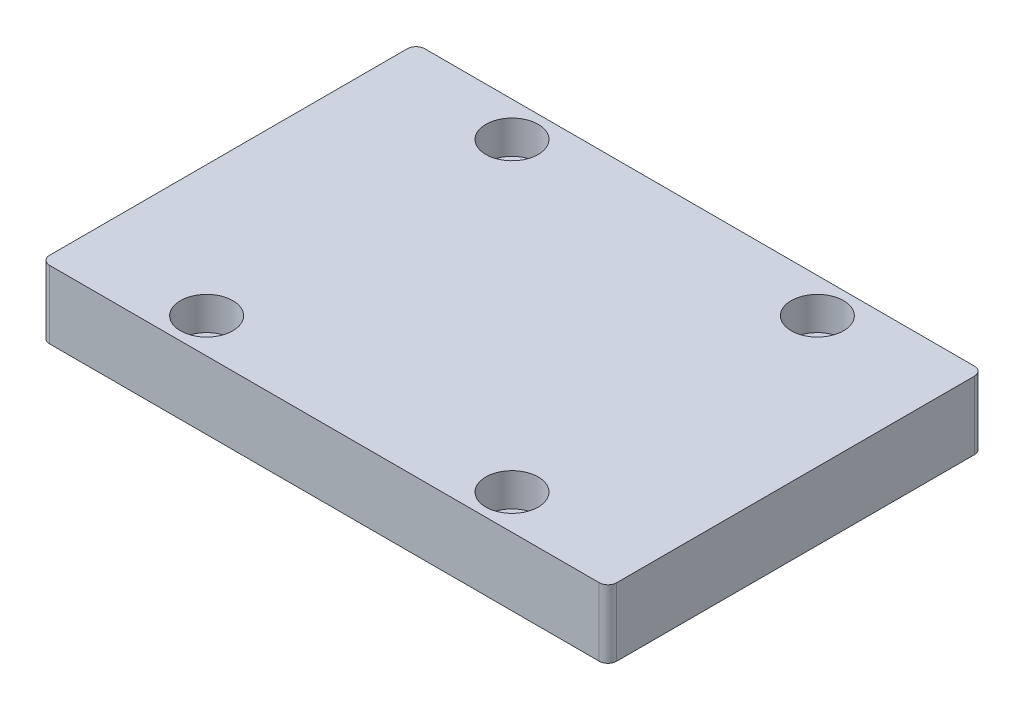
from build123d import *

# Parameters (mm, degrees)
SKETCH2_W           = 65
SKETCH2_H           = 43
BOSS_EXTRUDE1_DEPTH = 7.8
FILLET1_R           = 1
CUT_EXTRUDE1_REACH  = 41.741
SKETCH3_R           = 1.6
SKETCH4_R           = 3
CUT_EXTRUDE2_DEPTH  = 3.8


with BuildPart() as part:
    # Sketch2 → Boss-Extrude1 (new body)
    with BuildSketch(Plane(origin=(0, 0, 0), x_dir=(1, 0, 0), z_dir=(0, 1, 0))):
        Rectangle(SKETCH2_W, SKETCH2_H)
    extrude(amount=BOSS_EXTRUDE1_DEPTH)

    # Fillet1
    fillet1_edges = [part.edges().sort_by_distance(p)[0] for p in [
        (32.5, 3.9, -21.5),
        (-32.5, 3.9, -21.5),
        (-32.5, 3.9, 21.5),
        (32.5, 3.9, 21.5),
    ]]
    fillet(fillet1_edges, radius=FILLET1_R)

    # Sketch3 → Cut-Extrude1 (cut, up to next)
    with BuildSketch(Plane(origin=(0, 7.8, 0), x_dir=(1, 0, 0), z_dir=(0, 1, 0)), mode=Mode.PRIVATE) as cut_extrude1_sk1:
        with Locations((-17.5, 17.5)):
            Circle(SKETCH3_R)
    cut_extrude1_tool1 = extrude(cut_extrude1_sk1.sketch, amount=-CUT_EXTRUDE1_REACH, mode=Mode.PRIVATE) & part.part
    # Sketch3 → Cut-Extrude1 (cut, up to next)
    with BuildSketch(Plane(origin=(0, 7.8, 0), x_dir=(1, 0, 0), z_dir=(0, 1, 0)), mode=Mode.PRIVATE) as cut_extrude1_sk2:
        with Locations((17.5, 17.5)):
            Circle(SKETCH3_R)
    cut_extrude1_tool2 = extrude(cut_extrude1_sk2.sketch, amount=-CUT_EXTRUDE1_REACH, mode=Mode.PRIVATE) & part.part
    # Sketch3 → Cut-Extrude1 (cut, up to next)
    with BuildSketch(Plane(origin=(0, 7.8, 0), x_dir=(1, 0, 0), z_dir=(0, 1, 0)), mode=Mode.PRIVATE) as cut_extrude1_sk3:
        with Locations((17.5, -17.5)):
            Circle(SKETCH3_R)
    cut_extrude1_tool3 = extrude(cut_extrude1_sk3.sketch, amount=-CUT_EXTRUDE1_REACH, mode=Mode.PRIVATE) & part.part
    # Sketch3 → Cut-Extrude1 (cut, up to next)
    with BuildSketch(Plane(origin=(0, 7.8, 0), x_dir=(1, 0, 0), z_dir=(0, 1, 0)), mode=Mode.PRIVATE) as cut_extrude1_sk4:
        with Locations((-17.5, -17.5)):
            Circle(SKETCH3_R)
    cut_extrude1_tool4 = extrude(cut_extrude1_sk4.sketch, amount=-CUT_EXTRUDE1_REACH, mode=Mode.PRIVATE) & part.part
    add(cut_extrude1_tool1.solids().sort_by_distance((-17.5, 7.8, -17.5))[0], mode=Mode.SUBTRACT)
    add(cut_extrude1_tool2.solids().sort_by_distance((17.5, 7.8, -17.5))[0], mode=Mode.SUBTRACT)
    add(cut_extrude1_tool3.solids().sort_by_distance((17.5, 7.8, 17.5))[0], mode=Mode.SUBTRACT)
    add(cut_extrude1_tool4.solids().sort_by_distance((-17.5, 7.8, 17.5))[0], mode=Mode.SUBTRACT)

    # Sketch4 → Cut-Extrude2 (cut)
    with BuildSketch(Plane(origin=(0, 7.8, 0), x_dir=(1, 0, 0), z_dir=(0, 1, 0))):
        with Locations((-17.5, 17.5)):
            Circle(SKETCH4_R)
        with Locations((17.5, 17.5)):
            Circle(SKETCH4_R)
        with Locations((17.5, -17.5)):
            Circle(SKETCH4_R)
        with Locations((-17.5, -17.5)):
            Circle(SKETCH4_R)
    extrude(amount=-CUT_EXTRUDE2_DEPTH, mode=Mode.SUBTRACT)


solid = part.part
